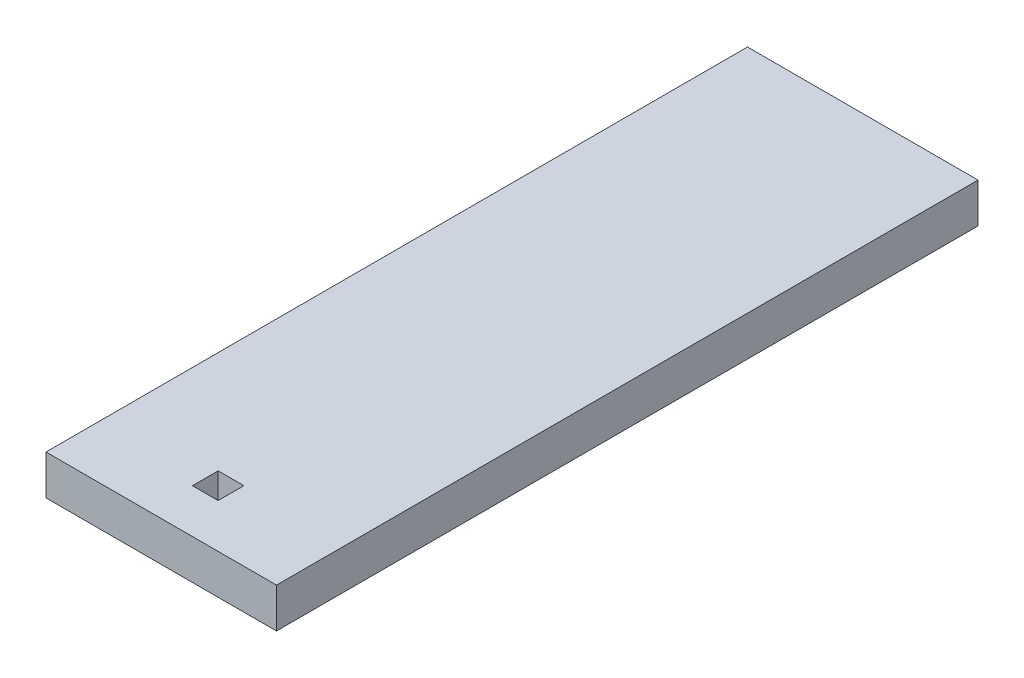
from build123d import *

# Parameters (mm, degrees)
SKETCH1_W           = 21.575
SKETCH1_H           = 56
SKETCH1_W_2         = 2.05
SKETCH1_H_2         = 2.05
BOSS_EXTRUDE1_DEPTH = 3.175
SKETCH2_W           = 3.175
SKETCH2_H           = 56
CUT_EXTRUDE1_DEPTH  = 31.776959726


with BuildPart() as part:
    # Sketch1 → Boss-Extrude1 (new body)
    with BuildSketch(Plane(origin=(0, 0, 0), x_dir=(1, 0, 0), z_dir=(0, 1, 0))):
        with Locations((-1.5875, 0)):
            Rectangle(SKETCH1_W, SKETCH1_H)
        with Locations((0, -23.45800045)):
            Rectangle(SKETCH1_W_2, SKETCH1_H_2, mode=Mode.SUBTRACT)
    extrude(amount=BOSS_EXTRUDE1_DEPTH)

    # Sketch2 → Cut-Extrude1 (cut, through all)
    with BuildSketch(Plane(origin=(0, 3.175, 0), x_dir=(1, 0, 0), z_dir=(0, 1, 0))):
        with Locations((-10.7875, 0)):
            Rectangle(SKETCH2_W, SKETCH2_H)
    extrude(amount=-CUT_EXTRUDE1_DEPTH, mode=Mode.SUBTRACT)


solid = part.part
